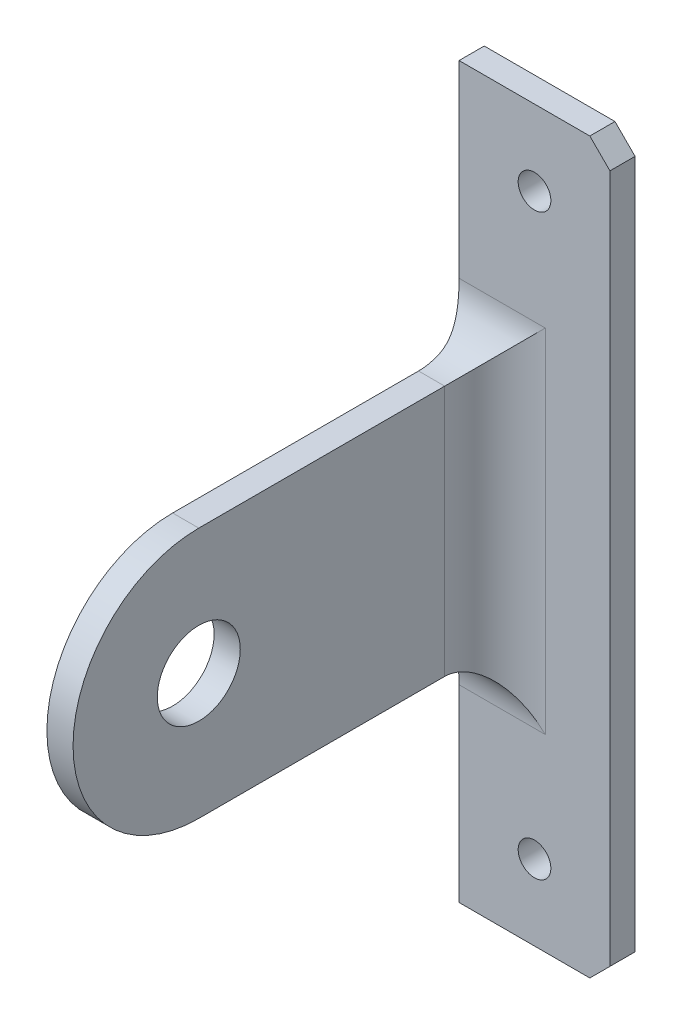
from build123d import *

# Parameters (mm, degrees)
SKETCH1_R               = 4.125
BOSS_EXTRUDE1_DEPTH     = 2.6
BOSS_EXTRUDE4_DEPTH     = 2.5
CUT_EXTRUDE2_REACH      = 80.314
SKETCH7_W               = 7
SKETCH7_H               = 16.5
SKETCH7_W_2             = 16
SKETCH7_H_2             = 8
CUT_EXTRUDE3_REACH      = 82.041
SKETCH9_W               = 2.6
SKETCH9_H               = 22.388822383
SKETCH8_W               = 2.6
SKETCH8_H               = 27.825
BOSS_EXTRUDE5_DEPTH     = 12.5
FILLET2_R               = 1
FILLET3_R               = 4
CUT_EXTRUDE4_DEPTH      = 74.103052287
CUT_EXTRUDE4_DEPTH_BACK = 74.103052287
SKETCH10_W              = 78.235731334
SKETCH10_H              = 6.290045588
SKETCH11_W              = 15
SKETCH11_H              = 2.5
BOSS_EXTRUDE6_DEPTH     = 12.5
BOSS_EXTRUDE7_DEPTH     = 2.5
SKETCH14_R              = 1.625
CUT_EXTRUDE5_DEPTH      = 2.5
FILLET4_R               = 5
CHAMFER1_SIZE           = 2


with BuildPart() as part:
    # Sketch1 → Boss-Extrude1 (new body)
    with BuildSketch(Plane(origin=(0, 0, 0), x_dir=(0, 0, -1), z_dir=(1, 0, 0))):
        with BuildLine():
            Line((0, 12.5), (34.45, 12.5))
            Line((34.45, 12.5), (34.45, -12.5))
            Line((34.45, -12.5), (0, -12.5))
            ThreePointArc((0, -12.5), (-12.5, 0), (0, 12.5))
        make_face()
        Circle(SKETCH1_R, mode=Mode.SUBTRACT)
    extrude(amount=BOSS_EXTRUDE1_DEPTH)

    # Sketch6 → Boss-Extrude4 (add)
    with BuildSketch(Plane(origin=(0, 0, -34.45), x_dir=(-1, 0, 0), z_dir=(0, 0, -1))):
        Polygon((-8.812505246, 36.25), (53.321583376, 36.25), (53.321583376, -36.25), (6.25, -36.25), (-19.178416624, -36.25), (-19.178416624, 36.25), align=None)
    extrude(amount=-BOSS_EXTRUDE4_DEPTH)

    # Sketch7 → Cut-Extrude2 (cut, up to next)
    with BuildSketch(Plane.XY.offset(-31.95), mode=Mode.PRIVATE) as cut_extrude2_sk1:
        with Locations((-1.711858899, -11.632438111)):
            Rectangle(SKETCH7_W, SKETCH7_H)
    cut_extrude2_tool1 = extrude(cut_extrude2_sk1.sketch, amount=-CUT_EXTRUDE2_REACH, mode=Mode.PRIVATE) & part.part
    # Sketch7 → Cut-Extrude2 (cut, up to next)
    with BuildSketch(Plane.XY.offset(-31.95), mode=Mode.PRIVATE) as cut_extrude2_sk2:
        with Locations((-16.5, 0)):
            Rectangle(SKETCH7_W_2, SKETCH7_H_2)
    cut_extrude2_tool2 = extrude(cut_extrude2_sk2.sketch, amount=-CUT_EXTRUDE2_REACH, mode=Mode.PRIVATE) & part.part
    add(cut_extrude2_tool1.solids().sort_by_distance((-1.711859, -11.632438, -31.95))[0], mode=Mode.SUBTRACT)
    add(cut_extrude2_tool2.solids().sort_by_distance((-16.5, 0, -31.95))[0], mode=Mode.SUBTRACT)

    # Sketch9 → Cut-Extrude3 (cut, up to next)
    with BuildSketch(Plane.XZ.offset(12.5), mode=Mode.PRIVATE) as cut_extrude3_sk1:
        with Locations((1.3, -20.755588809)):
            Rectangle(SKETCH9_W, SKETCH9_H)
    cut_extrude3_tool1 = extrude(cut_extrude3_sk1.sketch, amount=-CUT_EXTRUDE3_REACH, mode=Mode.PRIVATE) & part.part
    add(cut_extrude3_tool1.solids().sort_by_distance((1.3, -12.5, -20.755589))[0], mode=Mode.SUBTRACT)


with BuildPart() as cut_extrude3_piece_1:
    # of the separate pieces the step leaves, piece 1, a body of its own (cut_extrude3_pieces)
    add(part.part.solids().sort_by_distance((-53.321583376, 36.25, -31.95))[0])



with BuildPart() as cut_extrude3_piece_2:
    # of the separate pieces the step leaves, piece 2, a body of its own (cut_extrude3_pieces)
    add(part.part.solids().sort_by_distance((0, 12.5, 0))[0])


with BuildPart() as cut_extrude3_piece_1_1:
    add(cut_extrude3_piece_1.part)

    add(cut_extrude3_piece_2.part)  # Boss-Extrude5 merges Cut-Extrude3 piece 2
    # Sketch8 → Boss-Extrude5 (add, symmetric)
    with BuildSketch(Plane(origin=(0, 0, 0), x_dir=(1, 0, 0), z_dir=(0, 1, 0))):
        with Locations((1.3, 18.0375)):
            Rectangle(SKETCH8_W, SKETCH8_H)
    extrude(amount=BOSS_EXTRUDE5_DEPTH, both=True)

    # Fillet2
    fillet2_edges = [cut_extrude3_piece_1_1.edges().sort_by_distance(p)[0] for p in [
        (-8.5, 4, -33.2),
        (-8.5, -4, -33.2),
        (-24.5, -4, -33.2),
        (-24.5, 4, -33.2),
        (-5.211858899, -19.882438111, -33.2),
        (-5.211858899, -3.382438111, -33.2),
        (1.788141101, -3.382438111, -33.2),
        (1.788141101, -19.882438111, -33.2),
    ]]
    fillet(fillet2_edges, radius=FILLET2_R)

    # Fillet3
    fillet3_edges = [cut_extrude3_piece_1_1.edges().sort_by_distance(p)[0] for p in [
        (19.178416624, 36.25, -33.2),
        (-53.321583376, 36.25, -33.2),
        (-53.321583376, -36.25, -33.2),
        (19.178416624, -36.25, -33.2),
    ]]
    fillet(fillet3_edges, radius=FILLET3_R)

    # Sketch10 → Cut-Extrude4 (cut, two sides: drawn at the far end of the back side and taken through both)
    with BuildSketch(Plane(origin=(0, 0, 0), x_dir=(1, 0, 0), z_dir=(0, 1, 0)).offset(-CUT_EXTRUDE4_DEPTH_BACK)):
        with Locations((-17.391929865, 35.095022794)):
            Rectangle(SKETCH10_W, SKETCH10_H)
    extrude(amount=CUT_EXTRUDE4_DEPTH + CUT_EXTRUDE4_DEPTH_BACK, mode=Mode.SUBTRACT)

    # Sketch11 → Boss-Extrude6 (add, symmetric)
    with BuildSketch(Plane(origin=(0, 0, 0), x_dir=(1, 0, 0), z_dir=(0, 1, 0))):
        with Locations((6.53, 30.7)):
            Rectangle(SKETCH11_W, SKETCH11_H)
    boss_extrude6 = extrude(amount=BOSS_EXTRUDE6_DEPTH, both=True)

    # Sketch13 → Boss-Extrude7 (add)
    with BuildSketch(Plane(origin=(0, 0, -31.95), x_dir=(-1, 0, 0), z_dir=(0, 0, -1))):
        Polygon((-14.03, 12.5), (0.97, 12.5), (0.97, 36.25), (-10.03, 36.25), (-14.03, 36.25), (-14.03, 32.25), align=None)
    boss_extrude7 = extrude(amount=-BOSS_EXTRUDE7_DEPTH)

    # Mirror1: Boss-Extrude6, Boss-Extrude7 across plane
    add(boss_extrude6.mirror(Plane.ZX))
    add(boss_extrude7.mirror(Plane.ZX))

    # Sketch14 → Cut-Extrude5 (cut)
    with BuildSketch(Plane(origin=(0, 0, -31.95), x_dir=(-1, 0, 0), z_dir=(0, 0, -1))):
        with Locations((-6.53, 28.75)):
            Circle(SKETCH14_R)
    cut_extrude5 = extrude(amount=-CUT_EXTRUDE5_DEPTH, mode=Mode.SUBTRACT)

    # Mirror2: Cut-Extrude5 across plane
    add(cut_extrude5.mirror(Plane.ZX), mode=Mode.SUBTRACT)

    # Fillet4
    # the kernel refuses this fillet: 5 mm, written as the material it adds along each edge
    with BuildSketch(Plane(origin=(2.6, -12.5, -29.45), x_dir=(1, 0, 0), z_dir=(0, 1, 0))) as fillet4_piece_1:
        with BuildLine():
            CenterArc((FILLET4_R, -FILLET4_R), FILLET4_R, 90, 90)
            Line((0, -FILLET4_R), (-FILLET4_R * 0.02, -FILLET4_R))
            Line((-FILLET4_R * 0.02, -FILLET4_R), (-FILLET4_R * 0.02, FILLET4_R * 0.02))
            Line((-FILLET4_R * 0.02, FILLET4_R * 0.02), (FILLET4_R, FILLET4_R * 0.02))
            Line((FILLET4_R, FILLET4_R * 0.02), (FILLET4_R, 0))
        make_face()
    extrude(amount=25)
    with BuildSketch(Plane(origin=(0, -12.5, -29.45), x_dir=(-1, 0, 0), z_dir=(0, 1, 0))) as fillet4_piece_2:
        with BuildLine():
            CenterArc((5, 2.959577673), FILLET4_R, 180, 36.293058493)
            Line((0, 2.959577673), (-0.1, 2.959577673))
            Line((-0.1, 2.959577673), (-0.1, 0))
            Line((-0.1, 0), (0, -0.1))
            ThreePointArc((0, -0.1), (0.485, -0.1), (0.8894, -0.059191553))
            Line((0.8894, -0.059191553), (0.97, 0))
        make_face()
    extrude(amount=25)
    with BuildSketch(Plane(origin=(2.6, 12.5, -29.45), x_dir=(0, 0, 1), z_dir=(-1, 0, 0)), Plane(origin=(2.6, -12.5, -29.45), x_dir=(0, -1, 0), z_dir=(-1, 0, 0))) as fillet4_piece_3:
        with BuildLine():
            CenterArc((FILLET4_R, FILLET4_R), FILLET4_R, 180, 90)
            Line((0, FILLET4_R), (-FILLET4_R * 0.02, FILLET4_R))
            Line((-FILLET4_R * 0.02, FILLET4_R), (-FILLET4_R * 0.02, -FILLET4_R * 0.02))
            Line((-FILLET4_R * 0.02, -FILLET4_R * 0.02), (FILLET4_R, -FILLET4_R * 0.02))
            Line((FILLET4_R, -FILLET4_R * 0.02), (FILLET4_R, 0))
        make_face()
    extrude(amount=2.6)
    with BuildSketch(Plane(origin=(2.6, -25, -29.45), x_dir=(1, 0, 0), z_dir=(0, 1, 0))) as fillet4_piece_4a_section:
        with BuildLine():
            CenterArc((FILLET4_R, -FILLET4_R), FILLET4_R, 90, 90)
            Line((0, -FILLET4_R), (-FILLET4_R * 0.02, -FILLET4_R))
            Line((-FILLET4_R * 0.02, -FILLET4_R), (-FILLET4_R * 0.02, FILLET4_R * 0.02))
            Line((-FILLET4_R * 0.02, FILLET4_R * 0.02), (FILLET4_R, FILLET4_R * 0.02))
            Line((FILLET4_R, FILLET4_R * 0.02), (FILLET4_R, 0))
        make_face()
    fillet4_piece_4a = extrude(amount=37.5, mode=Mode.PRIVATE)
    fillet4_piece_4a = split(fillet4_piece_4a, bisect_by=Plane(origin=(3.731975571, -12.5, -28.318024429), z_dir=(0, -1, 0)), keep=Keep.TOP, mode=Mode.PRIVATE)
    with BuildSketch(Plane(origin=(15.1, -12.5, -29.45), x_dir=(0, -1, 0), z_dir=(-1, 0, 0))) as fillet4_piece_4b_section:
        with BuildLine():
            CenterArc((FILLET4_R, FILLET4_R), FILLET4_R, 180, 90)
            Line((0, FILLET4_R), (-FILLET4_R * 0.02, FILLET4_R))
            Line((-FILLET4_R * 0.02, FILLET4_R), (-FILLET4_R * 0.02, -FILLET4_R * 0.02))
            Line((-FILLET4_R * 0.02, -FILLET4_R * 0.02), (FILLET4_R, -FILLET4_R * 0.02))
            Line((FILLET4_R, -FILLET4_R * 0.02), (FILLET4_R, 0))
        make_face()
    fillet4_piece_4b = extrude(amount=15.1, mode=Mode.PRIVATE)
    fillet4_piece_4b = split(fillet4_piece_4b, bisect_by=Plane(origin=(14.03, -13.631975571, -28.318024429), z_dir=(-1, 0, 0)), keep=Keep.TOP, mode=Mode.PRIVATE)
    fillet4_piece_4b = split(fillet4_piece_4b, bisect_by=Plane(origin=(2.6, -13.631975571, -28.318024429), z_dir=(1, 0, 0)), keep=Keep.TOP, mode=Mode.PRIVATE)
    fillet4_piece_4 = fillet4_piece_4a & fillet4_piece_4b
    add(fillet4_piece_4)
    with BuildSketch(Plane(origin=(15.1, 12.5, -29.45), x_dir=(0, 0, 1), z_dir=(-1, 0, 0))) as fillet4_piece_5a_section:
        with BuildLine():
            CenterArc((FILLET4_R, FILLET4_R), FILLET4_R, 180, 90)
            Line((0, FILLET4_R), (-FILLET4_R * 0.02, FILLET4_R))
            Line((-FILLET4_R * 0.02, FILLET4_R), (-FILLET4_R * 0.02, -FILLET4_R * 0.02))
            Line((-FILLET4_R * 0.02, -FILLET4_R * 0.02), (FILLET4_R, -FILLET4_R * 0.02))
            Line((FILLET4_R, -FILLET4_R * 0.02), (FILLET4_R, 0))
        make_face()
    fillet4_piece_5a = extrude(amount=15.1, mode=Mode.PRIVATE)
    fillet4_piece_5a = split(fillet4_piece_5a, bisect_by=Plane(origin=(2.6, 13.631975571, -28.318024429), z_dir=(1, 0, 0)), keep=Keep.TOP, mode=Mode.PRIVATE)
    fillet4_piece_5a = split(fillet4_piece_5a, bisect_by=Plane(origin=(14.03, 13.631975571, -28.318024429), z_dir=(-1, 0, 0)), keep=Keep.TOP, mode=Mode.PRIVATE)
    with BuildSketch(Plane(origin=(2.6, -12.5, -29.45), x_dir=(1, 0, 0), z_dir=(0, 1, 0))) as fillet4_piece_5b_section:
        with BuildLine():
            CenterArc((FILLET4_R, -FILLET4_R), FILLET4_R, 90, 90)
            Line((0, -FILLET4_R), (-FILLET4_R * 0.02, -FILLET4_R))
            Line((-FILLET4_R * 0.02, -FILLET4_R), (-FILLET4_R * 0.02, FILLET4_R * 0.02))
            Line((-FILLET4_R * 0.02, FILLET4_R * 0.02), (FILLET4_R, FILLET4_R * 0.02))
            Line((FILLET4_R, FILLET4_R * 0.02), (FILLET4_R, 0))
        make_face()
    fillet4_piece_5b = extrude(amount=37.5, mode=Mode.PRIVATE)
    fillet4_piece_5b = split(fillet4_piece_5b, bisect_by=Plane(origin=(3.731975571, 12.5, -28.318024429), z_dir=(0, 1, 0)), keep=Keep.TOP, mode=Mode.PRIVATE)
    fillet4_piece_5 = fillet4_piece_5a & fillet4_piece_5b
    add(fillet4_piece_5)
    with BuildSketch(Plane(origin=(2.6, -12.5, -29.45), x_dir=(0, -1, 0), z_dir=(-1, 0, 0))) as fillet4_piece_6a_section:
        with BuildLine():
            CenterArc((FILLET4_R, FILLET4_R), FILLET4_R, 180, 90)
            Line((0, FILLET4_R), (-FILLET4_R * 0.02, FILLET4_R))
            Line((-FILLET4_R * 0.02, FILLET4_R), (-FILLET4_R * 0.02, -FILLET4_R * 0.02))
            Line((-FILLET4_R * 0.02, -FILLET4_R * 0.02), (FILLET4_R, -FILLET4_R * 0.02))
            Line((FILLET4_R, -FILLET4_R * 0.02), (FILLET4_R, 0))
        make_face()
    fillet4_piece_6a = extrude(amount=15.1, mode=Mode.PRIVATE)
    fillet4_piece_6a = split(fillet4_piece_6a, bisect_by=Plane(origin=(-0.97, -13.631975571, -28.318024429), z_dir=(1, 0, 0)), keep=Keep.TOP, mode=Mode.PRIVATE)
    fillet4_piece_6a = split(fillet4_piece_6a, bisect_by=Plane(origin=(0, -13.631975571, -28.318024429), z_dir=(-1, 0, 0)), keep=Keep.TOP, mode=Mode.PRIVATE)
    with BuildSketch(Plane(origin=(0, -19.898944181, -29.45), x_dir=(-1, 0, 0), z_dir=(0, 1, 0))) as fillet4_piece_6b_section:
        with BuildLine():
            CenterArc((5, 2.959577673), FILLET4_R, 180, 36.293058493)
            Line((0, 2.959577673), (-0.1, 2.959577673))
            Line((-0.1, 2.959577673), (-0.1, 0))
            Line((-0.1, 0), (0, -0.1))
            ThreePointArc((0, -0.1), (0.485, -0.1), (0.8894, -0.059191553))
            Line((0.8894, -0.059191553), (0.97, 0))
        make_face()
    fillet4_piece_6b = extrude(amount=32.398944181, mode=Mode.PRIVATE)
    fillet4_piece_6b = split(fillet4_piece_6b, bisect_by=Plane(origin=(-0.217435867, -12.5, -28.607978011), z_dir=(0, -1, 0)), keep=Keep.TOP, mode=Mode.PRIVATE)
    fillet4_piece_6 = fillet4_piece_6a & fillet4_piece_6b
    add(fillet4_piece_6)
    with BuildSketch(Plane(origin=(2.6, 12.5, -29.45), x_dir=(0, 0, 1), z_dir=(-1, 0, 0))) as fillet4_piece_7a_section:
        with BuildLine():
            CenterArc((FILLET4_R, FILLET4_R), FILLET4_R, 180, 90)
            Line((0, FILLET4_R), (-FILLET4_R * 0.02, FILLET4_R))
            Line((-FILLET4_R * 0.02, FILLET4_R), (-FILLET4_R * 0.02, -FILLET4_R * 0.02))
            Line((-FILLET4_R * 0.02, -FILLET4_R * 0.02), (FILLET4_R, -FILLET4_R * 0.02))
            Line((FILLET4_R, -FILLET4_R * 0.02), (FILLET4_R, 0))
        make_face()
    fillet4_piece_7a = extrude(amount=15.1, mode=Mode.PRIVATE)
    fillet4_piece_7a = split(fillet4_piece_7a, bisect_by=Plane(origin=(0, 13.631975571, -28.318024429), z_dir=(-1, 0, 0)), keep=Keep.TOP, mode=Mode.PRIVATE)
    fillet4_piece_7a = split(fillet4_piece_7a, bisect_by=Plane(origin=(-0.97, 13.631975571, -28.318024429), z_dir=(1, 0, 0)), keep=Keep.TOP, mode=Mode.PRIVATE)
    with BuildSketch(Plane(origin=(0, -12.5, -29.45), x_dir=(-1, 0, 0), z_dir=(0, 1, 0))) as fillet4_piece_7b_section:
        with BuildLine():
            CenterArc((5, 2.959577673), FILLET4_R, 180, 36.293058493)
            Line((0, 2.959577673), (-0.1, 2.959577673))
            Line((-0.1, 2.959577673), (-0.1, 0))
            Line((-0.1, 0), (0, -0.1))
            ThreePointArc((0, -0.1), (0.485, -0.1), (0.8894, -0.059191553))
            Line((0.8894, -0.059191553), (0.97, 0))
        make_face()
    fillet4_piece_7b = extrude(amount=32.398944181, mode=Mode.PRIVATE)
    fillet4_piece_7b = split(fillet4_piece_7b, bisect_by=Plane(origin=(-0.217435867, 12.5, -28.607978011), z_dir=(0, 1, 0)), keep=Keep.TOP, mode=Mode.PRIVATE)
    fillet4_piece_7 = fillet4_piece_7a & fillet4_piece_7b
    add(fillet4_piece_7)

    # Chamfer1
    chamfer1_edges = [cut_extrude3_piece_1_1.edges().sort_by_distance(p)[0] for p in [
        (14.03, 36.25, -30.7),
        (14.03, -36.25, -30.7),
    ]]
    chamfer(chamfer1_edges, length=CHAMFER1_SIZE)


solid = cut_extrude3_piece_1_1.part
